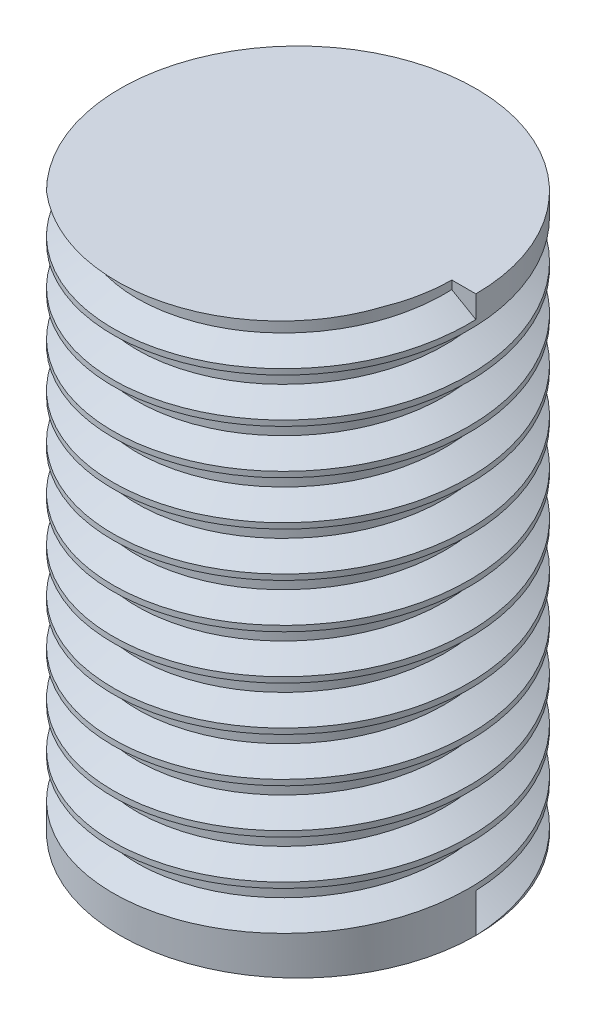
from build123d import *

# Parameters (mm, degrees)
SKETCH_1_W   = 8
SKETCH_1_H   = 25
THREAD_PITCH = 2


with BuildPart() as part:
    # Sketch 1 → Revolve 2 (revolve)
    with BuildSketch(Plane.XY, mode=Mode.PRIVATE) as revolve_2_sk:
        with Locations((4, 12.5)):
            Rectangle(SKETCH_1_W, SKETCH_1_H)
    revolve(revolve_2_sk.sketch.rotate(Axis((0, 0, 0), (0, 1, 0)), 90), axis=Axis((0, 0, 0), (0, 1, 0)))

    # Thread: the profile of Sketch 1 2 profile screwed along a right-hand helix of 12 turns, 10 arcs to a turn; built about Z, then put on its axis
    thread_z = Axis((0, 0, 0), (0, 0, 1))
    thread_corners = [(8.0003, 0, -0.000173205), (8.0003, 0, 1.7501732), (6.91746825, 0, 1.124999997), (6.91746825, 0, 0.624999997)]
    with BuildLine(mode=Mode.PRIVATE) as thread_profile:
        Line(thread_corners[0], thread_corners[1])
        Line(thread_corners[1], thread_corners[2])
        Line(thread_corners[2], thread_corners[3])
        Line(thread_corners[3], thread_corners[0])
    thread_cap = Face(thread_profile.wire())
    thread_turn_angles = [0, 18, 36, 54, 72, 90, 108, 126, 144, 162, 180, 198, 216, 234, 252, 270, 288, 306, 324, 342, 360]
    thread_turn_weights = [1, 0.9510565162951535, 1, 0.9510565162951535, 1, 0.9510565162951535, 1, 0.9510565162951535, 1, 0.9510565162951535, 1, 0.9510565162951535, 1, 0.9510565162951535, 1, 0.9510565162951535, 1, 0.9510565162951535, 1, 0.9510565162951535, 1]
    thread_turn_rails = [Edge.make_bspline([Vector(p[0], p[1], 0).rotate(thread_z, thread_turn_angles[k]) / thread_turn_weights[k] + Vector(0, 0, p[2] + THREAD_PITCH * thread_turn_angles[k] / 360) for k in range(21)], [0, 0, 0, 1, 1, 2, 2, 3, 3, 4, 4, 5, 5, 6, 6, 7, 7, 8, 8, 9, 9, 10, 10, 10], 2, thread_turn_weights) for p in thread_corners]
    thread_turn_sides = [Face.make_surface_from_curves(thread_turn_rails[p[0]], thread_turn_rails[p[1]]) for p in [(0, 1), (1, 2), (2, 3), (3, 0)]]
    thread = Plane(origin=(0, 0, 0), x_dir=(1, 0, 0), z_dir=(0, 1, 0)) * Solid(Shell([*[p.moved(Location((0, 0, THREAD_PITCH * i))) for i in range(12) for p in thread_turn_sides], thread_cap, thread_cap.rotate(thread_z, 4320).moved(Location((0, 0, THREAD_PITCH * 4320 / 360)))]))
    add(thread, mode=Mode.SUBTRACT)


solid = part.part
